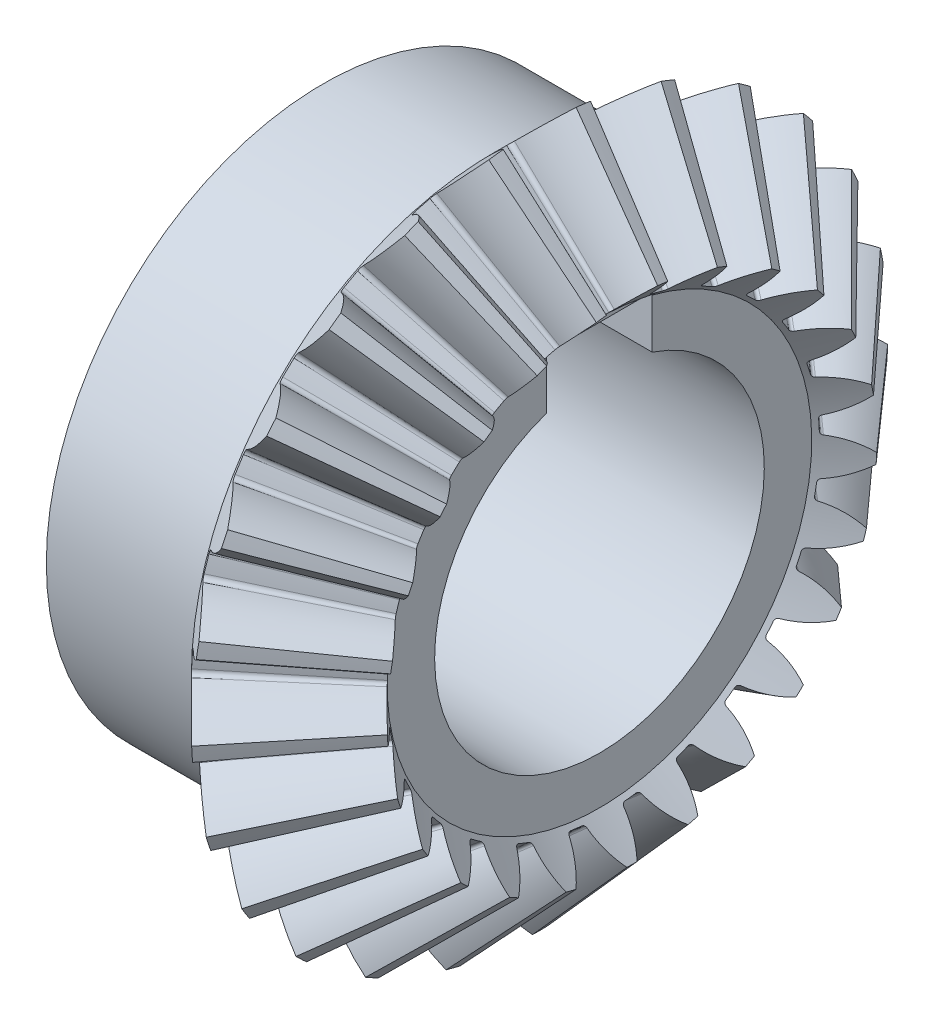
from build123d import *

# Parameters (mm, degrees)
TEETHCUTS_COUNT = 25
TEETHCUTS_ANGLE = 345.6
HUBSKE_R        = 21
HUB_DEPTH       = 12.899110576
BORSKE_R        = 12.5
BORE_DEPTH      = 40.0000508
KEYSKE_W        = 8
KEYSKE_H        = 15.8
KEYWAY_DEPTH    = 40.0000508


with BuildPart() as part:
    # BasProSke → Base-Revolve (revolve)
    with BuildSketch(Plane(origin=(0, 0, 0), x_dir=(1, 0, 0), z_dir=(0, 1, 0)), mode=Mode.PRIVATE) as base_revolve_sk:
        Polygon((0, 0), (0, 22.899008978), (3.515204589, 26.414213561), (10.519825784, 18.569592352), (8.048583697, 16.098350269), (8.048583697, 0), align=None)
    revolve(base_revolve_sk.sketch.rotate(Axis((-10, 0, 0), (1, 0, 0)), 180), axis=Axis((-10, 0, 0), (1, 0, 0)))

    # ToothCut: read off the stored shape, not the designer's step
    # ToothCut: loft between two sections, ruled curve by curve
    toothcut_from = [
        Edge.make_bspline([(27.107235452, 0.006244427, -0.009127086), (27.10293209, 0.001941065, -0.015015521), (27.096974187, -0.004016838, -0.014167989), (27.093586296, -0.007404729, -0.007185446)], [0, 0, 0, 0, 1, 1, 1, 1], 3, [1, 0.763644357, 0.763644357, 1]),
        Edge.make_bspline([(27.093586296, -0.007404729, 0.007185446), (27.096974187, -0.004016838, 0.014167989), (27.10293209, 0.001941065, 0.015015521), (27.107235452, 0.006244427, 0.009127086)], [0, 0, 0, 0, 1, 1, 1, 1], 3, [1, 0.763644357, 0.763644357, 1]),
        Edge.make_bspline([(27.093586296, -0.007404729, -0.007185446), (27.093127233, -0.007863792, -0.006239303), (27.092762474, -0.008228552, -0.005214333), (27.092498667, -0.008492359, -0.004129218)], [0, 0, 0, 0, 1, 1, 1, 1], 3, [1, 0.99392399, 0.99392399, 1]),
        Edge.make_bspline([(27.092498667, -0.008492359, 0.004129218), (27.092762474, -0.008228552, 0.005214333), (27.093127233, -0.007863792, 0.006239303), (27.093586296, -0.007404729, 0.007185446)], [0, 0, 0, 0, 1, 1, 1, 1], 3, [1, 0.99392399, 0.99392399, 1]),
        Edge.make_bspline([(27.092498667, -0.008492359, -0.004129218), (27.091841995, -0.009149031, -0.001428135), (27.091841995, -0.009149031, 0.001428135), (27.092498667, -0.008492359, 0.004129218)], [0, 0, 0, 0, 1, 1, 1, 1], 3, [1, 0.963778345, 0.963778345, 1]),
        Edge.make_line((27.107235452, 0.006244427, 0.009127086), (27.107235452, 0.006244427, -0.009127086)),
    ]
    toothcut_to = [
        Edge.make_bspline([(3.770187503, 26.669196475, -3.138335782), (2.862897257, 25.76190623, -2.047765835), (1.793050934, 24.692059909, -1.308474494), (0.627142214, 23.526151191, -0.966410602)], [0, 0, 0, 0, 1, 1, 1, 1], 3, [1, 0.979282483, 0.979282483, 1]),
        Edge.make_bspline([(0.627142214, 23.526151191, 0.966410602), (1.793050934, 24.692059909, 1.308474494), (2.862897257, 25.76190623, 2.047765835), (3.770187503, 26.669196475, 3.138335782)], [0, 0, 0, 0, 1, 1, 1, 1], 3, [1, 0.979282483, 0.979282483, 1]),
        Edge.make_bspline([(0.627142214, 23.526151191, -0.966410602), (0.495073972, 23.394082949, -0.927663334), (0.411300925, 23.310309902, -0.778165692), (0.414803535, 23.313812512, -0.587480466)], [0, 0, 0, 0, 1, 1, 1, 1], 3, [1, 0.844896568, 0.844896568, 1]),
        Edge.make_bspline([(0.414803535, 23.313812512, 0.587480466), (0.411300925, 23.310309902, 0.778165692), (0.495073972, 23.394082949, 0.927663334), (0.627142214, 23.526151191, 0.966410602)], [0, 0, 0, 0, 1, 1, 1, 1], 3, [1, 0.844896568, 0.844896568, 1]),
        Edge.make_bspline([(0.414803535, 23.313812512, -0.587480466), (0.421996833, 23.32100581, -0.195870858), (0.421996833, 23.32100581, 0.195870858), (0.414803535, 23.313812512, 0.587480466)], [0, 0, 0, 0, 1, 1, 1, 1], 3, [1, 0.999775178, 0.999775178, 1]),
        Edge.make_line((3.770187503, 26.669196475, 3.138335782), (3.770187503, 26.669196475, -3.138335782)),
    ]
    toothcut = Solid(Shell([*[Face.make_surface_from_curves(toothcut_from[k], toothcut_to[k]) for k in range(6)], Face(Wire(toothcut_from)), Face(Wire(toothcut_to))]))
    add(toothcut, mode=Mode.SUBTRACT)

    # TeethCuts: ToothCut ×25 about axis
    teethcuts_axis = Axis((-10, 0, 0), (1, 0, 0))
    for i in range(1, TEETHCUTS_COUNT):
        add(toothcut.rotate(teethcuts_axis, i * TEETHCUTS_ANGLE / (TEETHCUTS_COUNT - 1)), mode=Mode.SUBTRACT)

    # HubSke → Hub (add)
    with BuildSketch(Plane.ZY):
        with Locations(Location((0, 0, 0), (0, 0, 180))):
            Circle(HUBSKE_R)
    extrude(amount=HUB_DEPTH)

    # BorSke → Bore (cut, symmetric)
    with BuildSketch(Plane(origin=(0, 0, 0), x_dir=(0, 0, -1), z_dir=(1, 0, 0))):
        with Locations(Location((0, 0, 0), (0, 0, 180))):
            Circle(BORSKE_R)
    extrude(amount=BORE_DEPTH, both=True, mode=Mode.SUBTRACT)

    # KeySke → Keyway (cut, symmetric)
    with BuildSketch(Plane(origin=(0, 0, 0), x_dir=(0, 0, -1), z_dir=(1, 0, 0))):
        with Locations((0, 7.9)):
            Rectangle(KEYSKE_W, KEYSKE_H)
    extrude(amount=KEYWAY_DEPTH, both=True, mode=Mode.SUBTRACT)


solid = part.part
